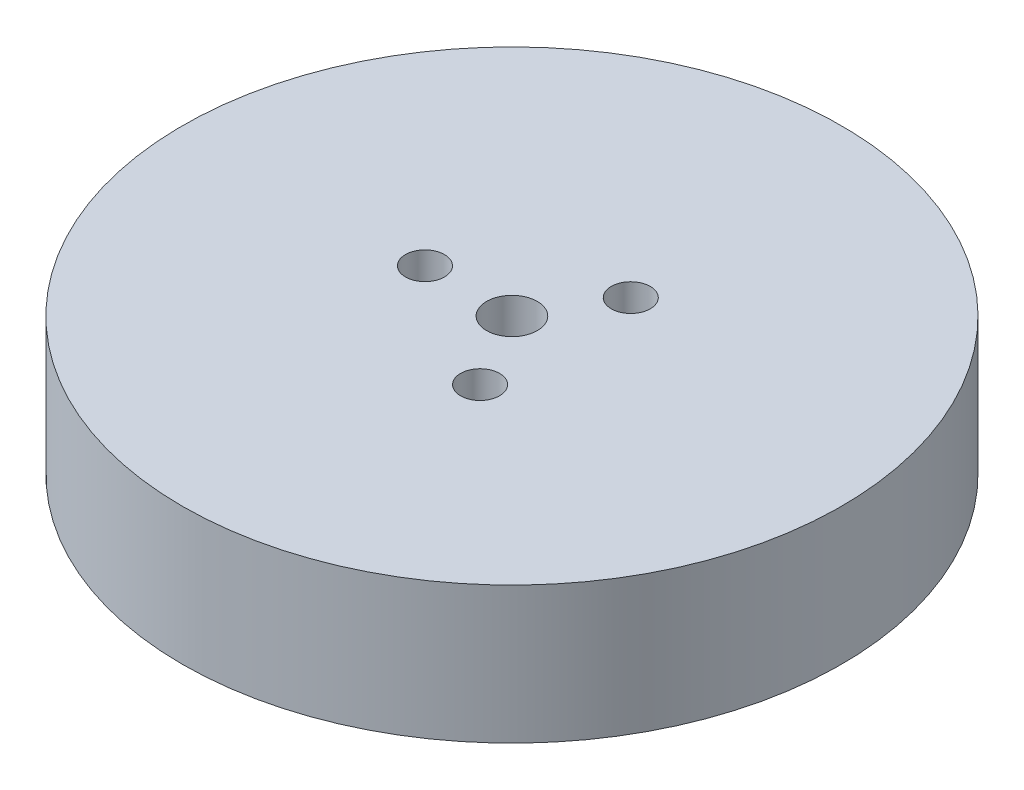
from build123d import *

# Parameters (mm, degrees)
SKETCH1_R           = 65
BOSS_EXTRUDE1_DEPTH = 27
SKETCH2_R           = 5
CUT_EXTRUDE1_DEPTH  = 96.807097858
SKETCH3_R           = 3.84182212
CUT_EXTRUDE2_DEPTH  = 21.563577577
CIRPATTERN1_COUNT   = 3


with BuildPart() as part:
    # Sketch1 → Boss-Extrude1 (new body)
    with BuildSketch(Plane(origin=(0, 0, 0), x_dir=(1, 0, 0), z_dir=(0, 1, 0))):
        Circle(SKETCH1_R)
    extrude(amount=BOSS_EXTRUDE1_DEPTH)

    # Sketch2 → Cut-Extrude1 (cut, through all)
    with BuildSketch(Plane(origin=(0, 0, 0), x_dir=(1, 0, 0), z_dir=(0, 1, 0))):
        Circle(SKETCH2_R)
    extrude(amount=CUT_EXTRUDE1_DEPTH, mode=Mode.SUBTRACT)

    # Sketch3 → Cut-Extrude2 (cut)
    with BuildSketch(Plane(origin=(0, 27, 0), x_dir=(1, 0, 0), z_dir=(0, 1, 0))):
        with Locations((-17.156712413, 0)):
            Circle(SKETCH3_R)
    cut_extrude2 = extrude(amount=-CUT_EXTRUDE2_DEPTH, mode=Mode.SUBTRACT)

    # CirPattern1: Cut-Extrude2 ×3 about axis
    cirpattern1_axis = Axis((0, 0, 0), (0, 1, 0))
    for i in range(1, CIRPATTERN1_COUNT):
        add(cut_extrude2.rotate(cirpattern1_axis, i * 360 / CIRPATTERN1_COUNT), mode=Mode.SUBTRACT)


solid = part.part
